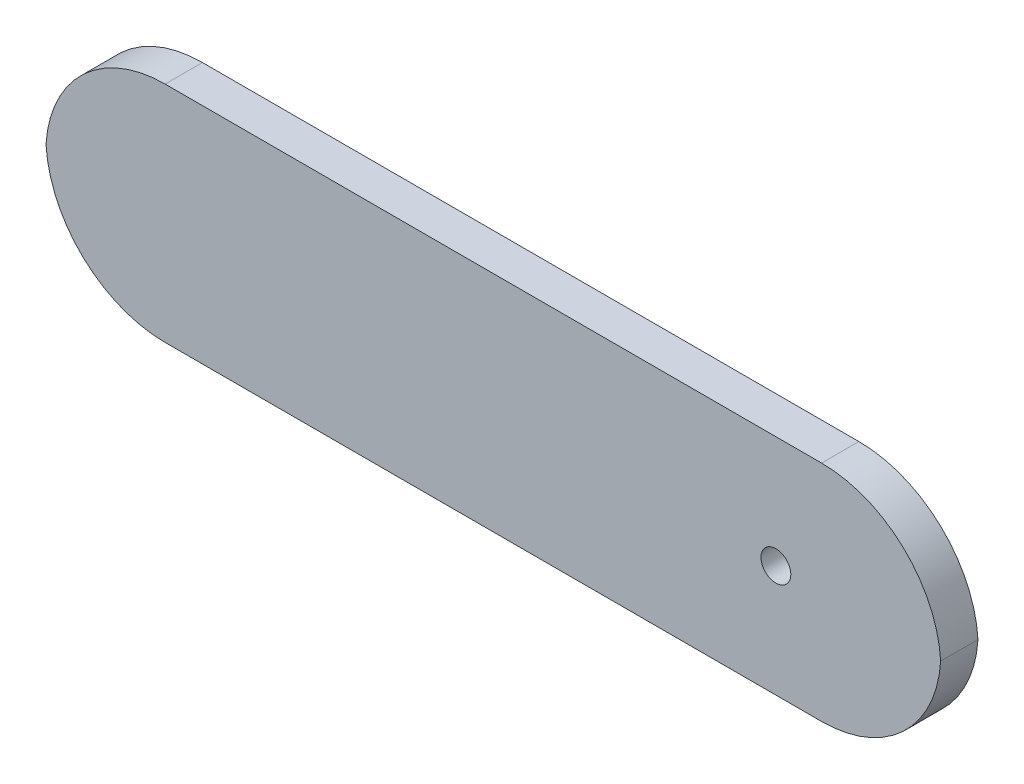
from build123d import *

# Parameters (mm, degrees)
SKETCH1_W           = 76.2
SKETCH1_H           = 19.05
BOSS_EXTRUDE1_DEPTH = 3.175
SKETCH2_R           = 1.27
CUT_EXTRUDE1_DEPTH  = 40.400713826
FILLET1_R           = 10.16


with BuildPart() as part:
    # Sketch1 → Boss-Extrude1 (new body)
    with BuildSketch(Plane.XY):
        Rectangle(SKETCH1_W, SKETCH1_H)
    extrude(amount=BOSS_EXTRUDE1_DEPTH)

    # Sketch2 → Cut-Extrude1 (cut, through all)
    with BuildSketch(Plane.XY.offset(3.175)):
        with Locations((24.051290482, 0)):
            Circle(SKETCH2_R)
    extrude(amount=-CUT_EXTRUDE1_DEPTH, mode=Mode.SUBTRACT)

    # Fillet1
    # the kernel refuses this fillet: 10.16 mm, written as the material it takes off along each edge
    with BuildSketch(Plane(origin=(-38.1, -9.525, -25.4), x_dir=(1, 0, 0), z_dir=(0, 0, 1)), Plane(origin=(-38.1, 9.525, -25.4), x_dir=(0, -1, 0), z_dir=(0, 0, 1))) as fillet1_piece_1:
        with BuildLine():
            CenterArc((FILLET1_R, FILLET1_R), FILLET1_R, 180, 90)
            Line((0, FILLET1_R), (0, 0))
            Line((0, 0), (FILLET1_R, 0))
        make_face()
    extrude(amount=53.975, mode=Mode.SUBTRACT)
    with BuildSketch(Plane(origin=(38.1, -9.525, -25.4), x_dir=(-1, 0, 0), z_dir=(0, 0, 1)), Plane(origin=(38.1, 9.525, -25.4), x_dir=(0, -1, 0), z_dir=(0, 0, 1))) as fillet1_piece_2:
        with BuildLine():
            CenterArc((FILLET1_R, -FILLET1_R), FILLET1_R, 90, 90)
            Line((0, -FILLET1_R), (0, 0))
            Line((0, 0), (FILLET1_R, 0))
        make_face()
    extrude(amount=53.975, mode=Mode.SUBTRACT)


solid = part.part
